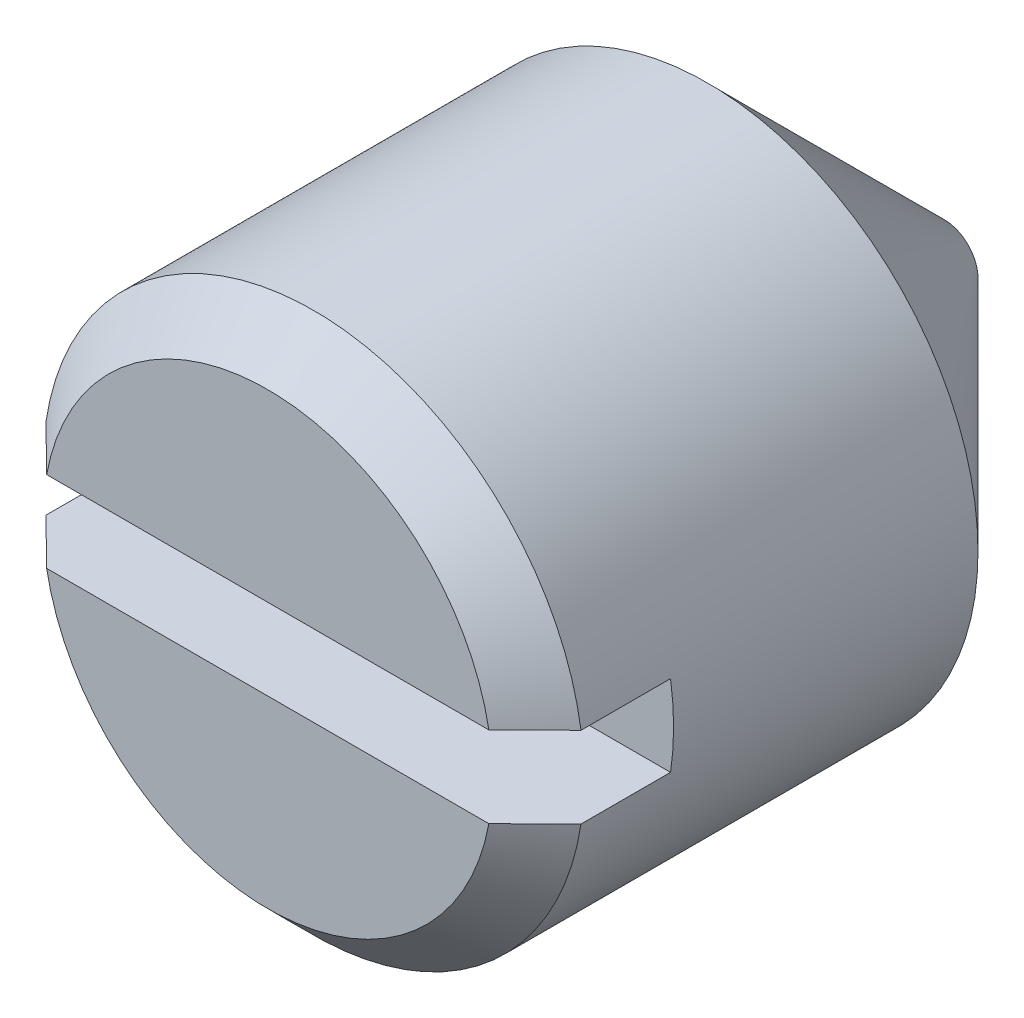
from build123d import *

# Parameters (mm, degrees)
SKETCH_2_R               = 4
EXTRUDE_1_DEPTH          = 10
CHAMFER_1_SIZE           = 3.5
CUT_EXTRUDE_1_DEPTH      = 12.489125293
CUT_EXTRUDE_1_DEPTH_BACK = 12.489125293
SKETCH_4_W               = 4
SKETCH_4_H               = 1.2


# Read off the part's stored shape, not the designer's step: M8 机械螺纹 螺柱1
with BuildPart() as part:
    # 草图2 → 凸台-拉伸1 (new body)
    with BuildSketch(Plane.XY):
        Circle(SKETCH_2_R)
    extrude(amount=EXTRUDE_1_DEPTH)

    # M8 机械螺纹 螺柱1 outline → M8 机械螺纹 螺柱1 (revolve, cut)
    with BuildSketch(Plane.XZ):
        Polygon((4, 10), (3.3235, 10), (4, 9.3235), align=None)
    revolve(axis=Axis((0, 0, 0), (0, 0, 1)), mode=Mode.SUBTRACT)

    # 倒角1
    chamfer_1_edges = [part.edges().sort_by_distance(p)[0] for p in [
        (-4, 0, 0),
    ]]
    chamfer(chamfer_1_edges, length=CHAMFER_1_SIZE)

    # 草图4 → 切除-拉伸1 (cut, two sides: drawn at the far end of the back side and taken through both)
    with BuildSketch(Plane(origin=(0, 0, 0), x_dir=(0, 0, -1), z_dir=(1, 0, 0)).offset(-CUT_EXTRUDE_1_DEPTH_BACK)):
        with Locations((-10, 0)):
            Rectangle(SKETCH_4_W, SKETCH_4_H)
    extrude(amount=CUT_EXTRUDE_1_DEPTH + CUT_EXTRUDE_1_DEPTH_BACK, mode=Mode.SUBTRACT)


solid = part.part
